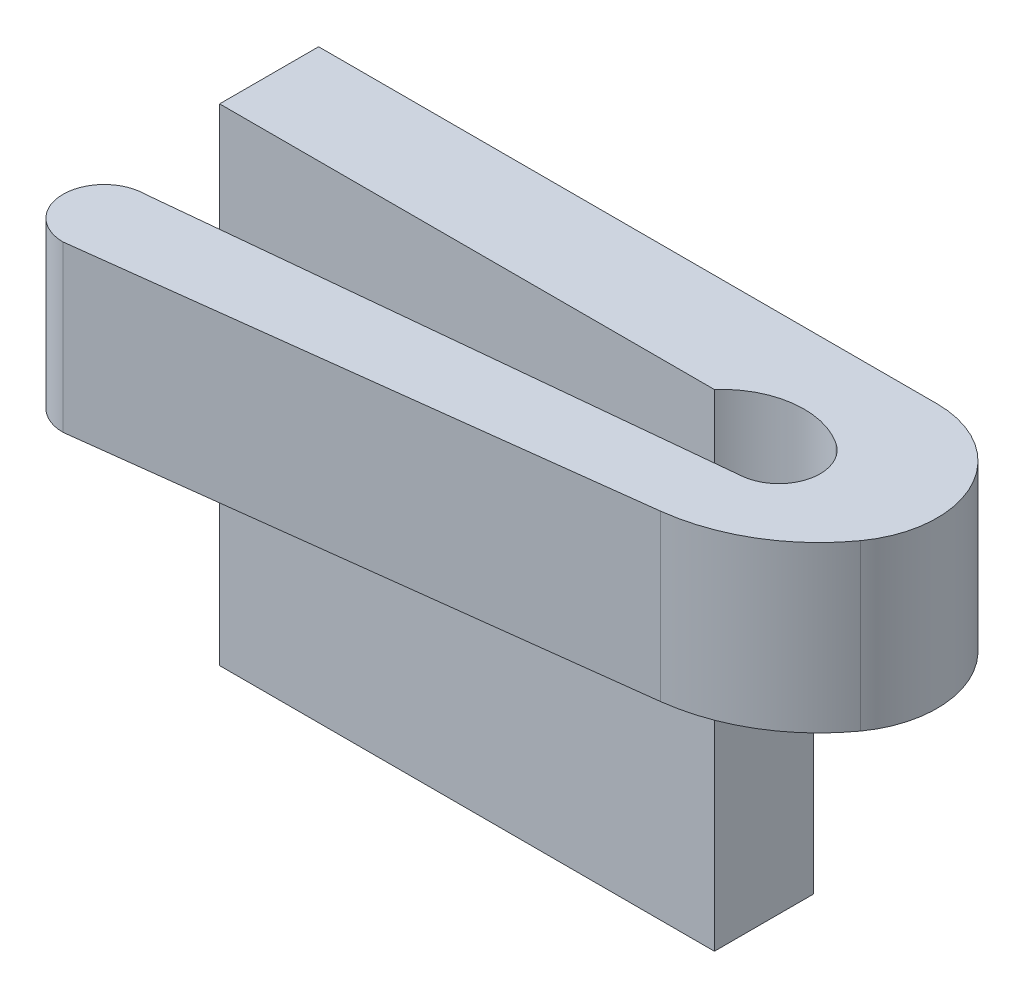
from build123d import *

# Parameters (mm, degrees)
BOSS_EXTRUDE1_DEPTH = 2
SKETCH2_W           = 6
SKETCH2_H           = 1.2
BOSS_EXTRUDE2_DEPTH = 3.9
FILLET1_DEPTH       = 2


with BuildPart() as part:
    # Sketch1 → Boss-Extrude1 (new body)
    with BuildSketch(Plane(origin=(0, 0, 0), x_dir=(1, 0, 0), z_dir=(0, 1, 0))):
        with BuildLine():
            Line((0, 1.2), (7.5, 1.2))
            ThreePointArc((7.5, 1.2), (8.567707825, 0.547722558), (8.474679434, -0.7))
            ThreePointArc((8.474679434, -0.7), (7.807430734, -1.311314361), (6.951049145, -1.603780854))
            Line((6.951049145, -1.603780854), (0.5, -2.4))
            ThreePointArc((0.5, -2.4), (0, -1.9), (0.5, -1.4))
            Line((0.5, -1.4), (7.5, -0.7))
            ThreePointArc((7.5, -0.7), (7.642928579, -0.35), (7.5, 0))
            ThreePointArc((7.5, 0), (6.75, 0.338562172), (6, 0))
            Line((6, 0), (0, 0))
            Line((0, 0), (0, 1.2))
        make_face()
    extrude(amount=BOSS_EXTRUDE1_DEPTH)

    # Sketch2 → Boss-Extrude2 (add)
    with BuildSketch(Plane(origin=(0, 0, 0), x_dir=(1, 0, 0), z_dir=(0, 1, 0))):
        with Locations((3, 0.6)):
            Rectangle(SKETCH2_W, SKETCH2_H)
    extrude(amount=-BOSS_EXTRUDE2_DEPTH)

    # Fillet1: read off the stored shape, not the designer's step
    # Fillet1 outline → Fillet1 (add)
    with BuildSketch(Plane(origin=(0, 0, 0), x_dir=(1, 0, 0), z_dir=(0, 1, 0))):
        with BuildLine():
            ThreePointArc((7.5, 0), (7.407145524, 0.092325902), (7.303023614, 0.171727751))
            ThreePointArc((7.303023614, 0.171727751), (7.511802782, -0.365240542), (7.076263667, -0.742373633))
            Line((7.076263667, -0.742373633), (7.5, -0.7))
            ThreePointArc((7.5, -0.7), (7.642928579, -0.35), (7.5, 0))
        make_face()
    extrude(amount=FILLET1_DEPTH)


solid = part.part
